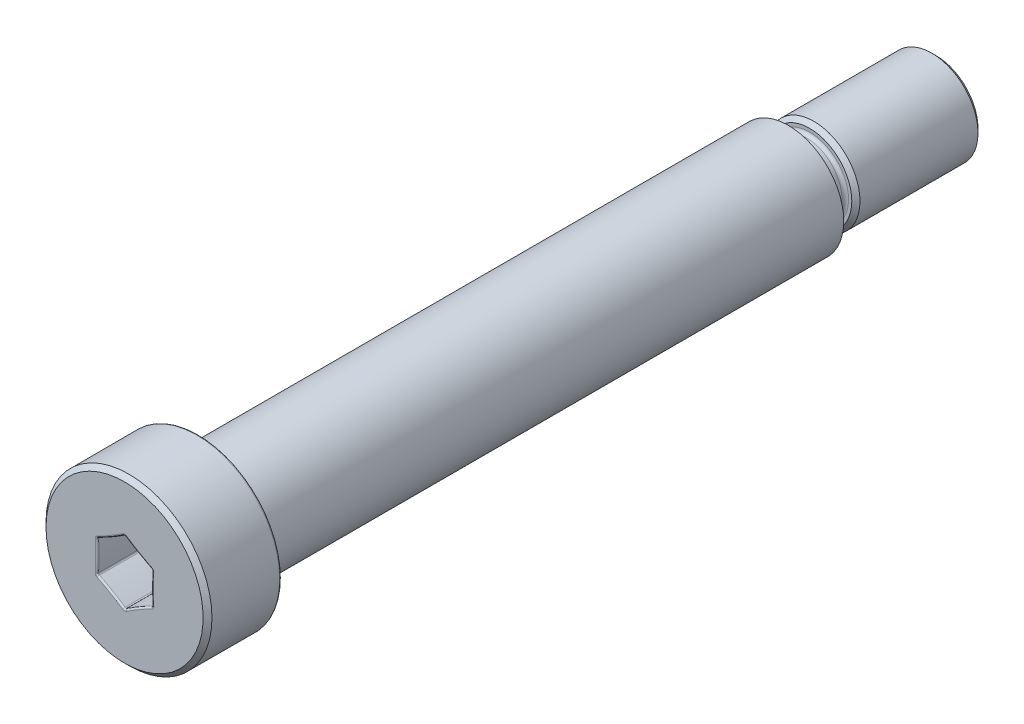
from build123d import *

# Parameters (mm, degrees)
SKETCH4_W          = 1.5875
SKETCH4_H          = 0.47625
SKETCH4_W_2        = 1.834444444
SKETCH4_H_2        = 0.916543552
CHAMFER1_SIZE      = 0.47625
FILLET1_R          = 0.28575
FILLET2_R          = 0.282222222
CHAMFER2_SIZE      = 0.352777778
CHAMFER3_SIZE      = 0.381
CUT_EXTRUDE1_DEPTH = 3.9751
FILLET4_R          = 0.142875


with BuildPart() as part:
    # Sketch3 → Revolve1 (revolve)
    with BuildSketch(Plane(origin=(0, 0, 0), x_dir=(0, 0, -1), z_dir=(1, 0, 0)), mode=Mode.PRIVATE) as revolve1_sk:
        Polygon((-6.35, 7.14375), (0, 7.14375), (0, 4.7625), (50.8, 4.7625), (50.8, 3.9751), (63.5, 3.9751), (63.5, 0), (-6.35, 0), align=None)
    revolve(revolve1_sk.sketch.rotate(Axis((0, 0, 6.35), (0, 0, -1)), 90), axis=Axis((0, 0, 6.35), (0, 0, -1)))

    # Sketch4 → Cut-Revolve1 (revolve, cut)
    with BuildSketch(Plane(origin=(0, 0, 0), x_dir=(0, 0, -1), z_dir=(1, 0, 0)), mode=Mode.PRIVATE) as cut_revolve1_sk:
        with Locations((0.79375, 4.524375)):
            Rectangle(SKETCH4_W, SKETCH4_H)
        with Locations((51.717222222, 3.516828224)):
            Rectangle(SKETCH4_W_2, SKETCH4_H_2)
    revolve(cut_revolve1_sk.sketch.rotate(Axis((0, 0, 6.35), (0, 0, -1)), 90), axis=Axis((0, 0, 6.35), (0, 0, -1)), mode=Mode.SUBTRACT)

    # Chamfer1
    chamfer1_edges = [part.edges().sort_by_distance(p)[0] for p in [
        (-4.28625, 0, -1.5875),
    ]]
    chamfer(chamfer1_edges, length=CHAMFER1_SIZE - 0.0001)  # a hair under: the kernel refuses the full size

    # Fillet1
    fillet1_edges = [part.edges().sort_by_distance(p)[0] for p in [
        (-4.28625, 0, 0),
    ]]
    fillet(fillet1_edges, radius=FILLET1_R)

    # Fillet2
    fillet2_edges = [part.edges().sort_by_distance(p)[0] for p in [
        (-3.058556448, 0, -50.8),
        (-3.058556448, 0, -52.634444444),
    ]]
    fillet(fillet2_edges, radius=FILLET2_R)

    # Chamfer2
    chamfer2_edges = [part.edges().sort_by_distance(p)[0] for p in [
        (-3.9751, 0, -52.634444444),
        (-3.9751, 0, -63.5),
    ]]
    chamfer(chamfer2_edges, length=CHAMFER2_SIZE)

    # Chamfer3
    chamfer3_edges = [part.edges().sort_by_distance(p)[0] for p in [
        (-7.14375, 0, 6.35),
    ]]
    chamfer(chamfer3_edges, length=CHAMFER3_SIZE)

    # Sketch5 → Cut-Extrude1 (cut)
    with BuildSketch(Plane.XY.offset(6.35)):
        with BuildLine():
            ThreePointArc((2.38125, 1.374815329), (1.1668125, 2.020978533), (0, 2.749630657))
            ThreePointArc((0, 2.749630657), (-1.1668125, 2.020978533), (-2.38125, 1.374815329))
            ThreePointArc((-2.38125, 1.374815329), (-2.333625, 0), (-2.38125, -1.374815329))
            ThreePointArc((-2.38125, -1.374815329), (-1.1668125, -2.020978533), (0, -2.749630657))
            ThreePointArc((0, -2.749630657), (1.1668125, -2.020978533), (2.38125, -1.374815329))
            ThreePointArc((2.38125, -1.374815329), (2.333625, 0), (2.38125, 1.374815329))
        make_face()
    extrude(amount=-CUT_EXTRUDE1_DEPTH, mode=Mode.SUBTRACT)

    # Fillet4
    fillet4_edges = [part.edges().sort_by_distance(p)[0] for p in [
        (2.333625, 0, 2.3749),
        (2.38125, 1.374815329, 4.36245),
        (1.1668125, -2.020978533, 2.3749),
        (2.38125, -1.374815329, 4.36245),
        (-1.1668125, -2.020978533, 2.3749),
        (0, -2.749630657, 4.36245),
        (-2.333625, 0, 2.3749),
        (-2.38125, -1.374815329, 4.36245),
        (-1.1668125, 2.020978533, 2.3749),
        (-2.38125, 1.374815329, 4.36245),
        (1.1668125, 2.020978533, 2.3749),
        (0, 2.749630657, 4.36245),
        (2.333625, 0, 6.35),
        (1.1668125, 2.020978533, 6.35),
        (-1.1668125, 2.020978533, 6.35),
        (-2.333625, 0, 6.35),
        (-1.1668125, -2.020978533, 6.35),
        (1.1668125, -2.020978533, 6.35),
        (-7.14375, 0, 0),
    ]]
    fillet(fillet4_edges, radius=FILLET4_R)


solid = part.part
